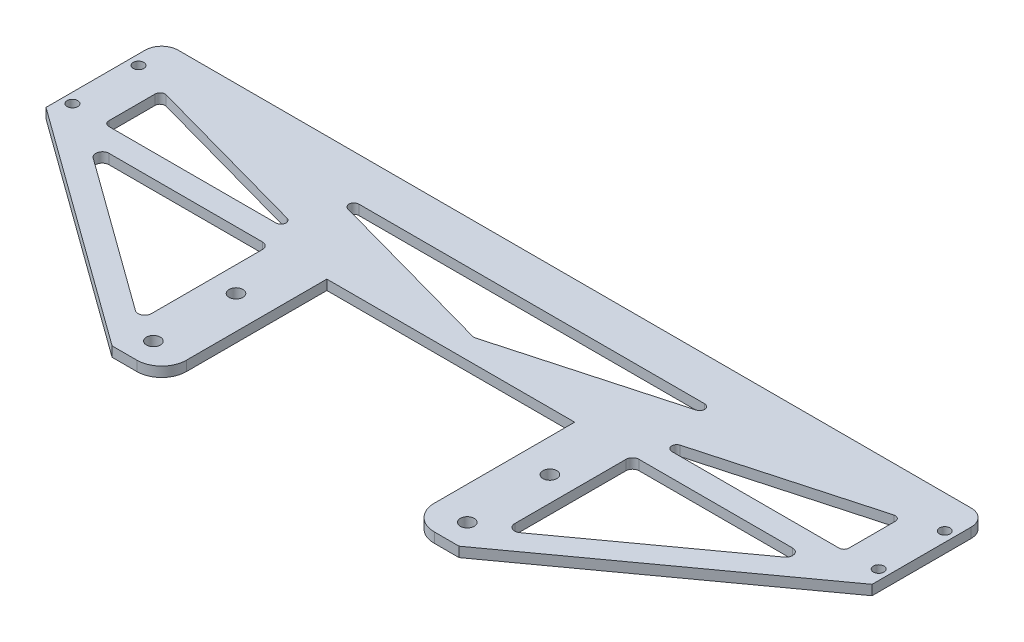
from build123d import *

# Parameters (mm, degrees)
SKETCH_1_R          = 1.6
SKETCH_1_R_2        = 2.1
EXTRUDE_1_DEPTH     = 3
FILLET_1_R          = 5
FILLET_2_R          = 7.5
CUT_EXTRUDE_1_DEPTH = 254.622258487


with BuildPart() as part:
    # 草图1 → 凸台-拉伸1 (new body)
    with BuildSketch(Plane(origin=(0, 0, 0), x_dir=(1, 0, 0), z_dir=(0, 1, 0))):
        Polygon((-3, 30), (-3, -5), (69.5, -57.5), (84.5, -57.5), (84.5, -7.5), (159.5, -7.5), (159.5, -57.5), (174.5, -57.5), (247, -5), (247, 30), align=None)
        with Locations((0, 20)):
            Circle(SKETCH_1_R, mode=Mode.SUBTRACT)
        Circle(SKETCH_1_R, mode=Mode.SUBTRACT)
        with Locations((244, 20)):
            Circle(SKETCH_1_R, mode=Mode.SUBTRACT)
        with Locations((244, 0)):
            Circle(SKETCH_1_R, mode=Mode.SUBTRACT)
        with Locations((74.5, -25)):
            Circle(SKETCH_1_R_2, mode=Mode.SUBTRACT)
        with Locations((169.5, -25)):
            Circle(SKETCH_1_R_2, mode=Mode.SUBTRACT)
        with Locations((74.5, -50)):
            Circle(SKETCH_1_R_2, mode=Mode.SUBTRACT)
        with Locations((169.5, -50)):
            Circle(SKETCH_1_R_2, mode=Mode.SUBTRACT)
        with BuildLine():
            Line((18.559297534, -7.5), (65, -7.5))
            ThreePointArc((65, -7.5), (66.414213562, -8.085786438), (67, -9.5))
            Line((67, -9.5), (67, -43.129474199))
            ThreePointArc((67, -43.129474199), (65.909384614, -44.910771374), (63.826980376, -44.749358442))
            Line((63.826980376, -44.749358442), (17.38627791, -11.119884243))
            ThreePointArc((17.38627791, -11.119884243), (16.656698196, -8.883464716), (18.559297534, -7.5))
        make_face(mode=Mode.SUBTRACT)
        with BuildLine():
            Line((180.173019624, -44.749358442), (226.61372209, -11.119884243))
            ThreePointArc((226.61372209, -11.119884243), (227.343301804, -8.883464716), (225.440702466, -7.5))
            Line((225.440702466, -7.5), (179, -7.5))
            ThreePointArc((179, -7.5), (177.585786438, -8.085786438), (177, -9.5))
            Line((177, -9.5), (177, -43.129474199))
            ThreePointArc((177, -43.129474199), (178.090615386, -44.910771374), (180.173019624, -44.749358442))
        make_face(mode=Mode.SUBTRACT)
    extrude(amount=EXTRUDE_1_DEPTH)

    # 圆角1
    fillet_1_edges = [part.edges().sort_by_distance(p)[0] for p in [
        (247, 1.5, -30),
        (-3, 1.5, -30),
    ]]
    fillet(fillet_1_edges, radius=FILLET_1_R)

    # 圆角2
    fillet_2_edges = [part.edges().sort_by_distance(p)[0] for p in [
        (159.5, 1.5, 57.5),
        (84.5, 1.5, 57.5),
    ]]
    fillet(fillet_2_edges, radius=FILLET_2_R)

    # 草图3 → 切除-拉伸1 (cut, through all)
    with BuildSketch(Plane(origin=(0, 3, 0), x_dir=(1, 0, 0), z_dir=(0, 1, 0))):
        with BuildLine():
            Line((10, 15.02762992), (10, 1))
            ThreePointArc((10, 1), (10.439339828, -0.060660172), (11.5, -0.5))
            Line((11.5, -0.5), (62.104084647, -0.5))
            ThreePointArc((62.104084647, -0.5), (63.590394858, 0.79780713), (62.50477975, 2.445490724))
            Line((62.50477975, 2.445490724), (11.900695103, 16.473120645))
            ThreePointArc((11.900695103, 16.473120645), (10.591991921, 16.221581899), (10, 15.02762992))
        make_face()
        with BuildLine():
            Line((69.691860168, 17), (174.308139832, 17))
            ThreePointArc((174.308139832, 17), (175.794450043, 15.70219287), (174.708834935, 14.054509276))
            Line((174.708834935, 14.054509276), (122.400695103, -0.445490724))
            ThreePointArc((122.400695103, -0.445490724), (122, -0.5), (121.599304897, -0.445490724))
            Line((121.599304897, -0.445490724), (69.291165065, 14.054509276))
            ThreePointArc((69.291165065, 14.054509276), (68.205549957, 15.70219287), (69.691860168, 17))
        make_face()
        with BuildLine():
            Line((232.5, -0.5), (181.895915353, -0.5))
            ThreePointArc((181.895915353, -0.5), (180.409605142, 0.79780713), (181.49522025, 2.445490724))
            Line((181.49522025, 2.445490724), (232.099304897, 16.473120645))
            ThreePointArc((232.099304897, 16.473120645), (233.408008079, 16.221581899), (234, 15.02762992))
            Line((234, 15.02762992), (234, 1))
            ThreePointArc((234, 1), (233.560660172, -0.060660172), (232.5, -0.5))
        make_face()
    extrude(amount=-CUT_EXTRUDE_1_DEPTH, mode=Mode.SUBTRACT)


solid = part.part
